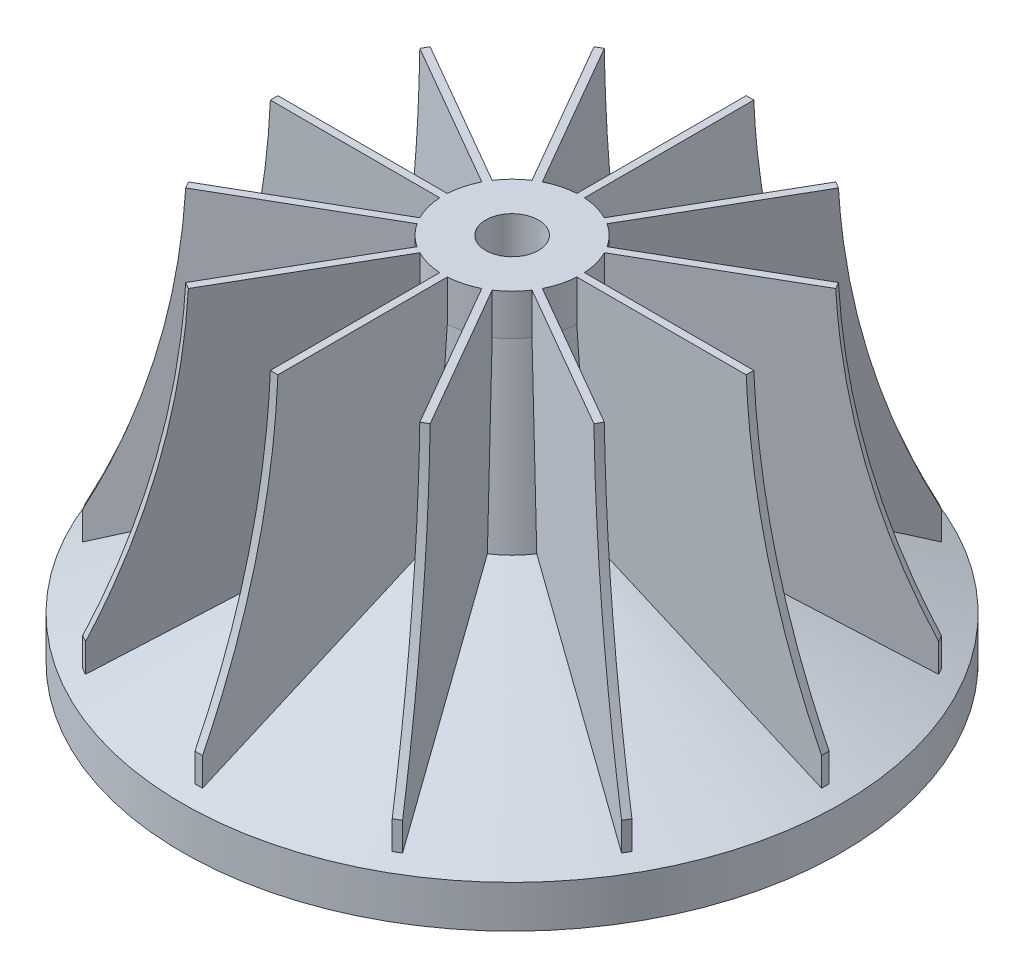
from build123d import *

# Parameters (mm, degrees)
BOSS_EXTRUDE5_REACH = 73.526
CIRPATTERN8_COUNT   = 12
CUT_EXTRUDE1_REACH  = 73.526
SKETCH6_R           = 3.175


with BuildPart() as part:
    # Sketch1 → Revolve1 (revolve)
    with BuildSketch(Plane.XY):
        Polygon((0, 0), (-39.624, 0), (-39.624, 5.08), (-9.822923796, 18.069281233), (-8.255, 39.518150017), (-8.255, 44.45), (0, 44.45), align=None)
    revolve(axis=Axis((0, 0, 0), (0, 1, 0)))

    # Sketch3 → Boss-Extrude5 (add, up to next)
    with BuildSketch(Plane(origin=(0, 44.45, 0), x_dir=(1, 0, 0), z_dir=(0, 1, 0)), mode=Mode.PRIVATE) as boss_extrude5_sk1:
        with BuildLine():
            Line((0.455930282, -37.670191496), (0.455991802, -8.206191496))
            add(Edge.make_bspline(
                [(-0.45593, -8.206191496), (3.0201e-05, -8.303808504), (0.455991802, -8.206191496)],
                knots=[0, 0, 0, 1, 1, 1], degree=2))
            Line((-0.45593, -8.206191496), (-0.45593, -37.670191496))
            Line((-0.45593, -37.670191496), (0.455930282, -37.670191496))
        make_face()
    boss_extrude5_tool1 = extrude(boss_extrude5_sk1.sketch, amount=-BOSS_EXTRUDE5_REACH, mode=Mode.PRIVATE) - part.part
    boss_extrude5 = boss_extrude5_tool1.solids().sort_by_distance((1.6e-05, 44.45, 22.954292))[0]
    add(boss_extrude5)

    # CirPattern8: Boss-Extrude5 ×12 about axis
    cirpattern8_axis = Axis((0, 18.069281233, 0), (0, 1, 0))
    for i in range(1, CIRPATTERN8_COUNT):
        add(boss_extrude5.rotate(cirpattern8_axis, i * 360 / CIRPATTERN8_COUNT))

    # Sketch7 → Cut-Revolve3 (revolve, cut)
    with BuildSketch(Plane(origin=(0, 0, 0), x_dir=(0, 0, -1), z_dir=(1, 0, 0))):
        with BuildLine():
            Line((-42.13340627, 53.486181243), (-28.575, 53.486181243))
            Line((-28.575, 53.486181243), (-28.575, 45.258268752))
            add(Edge.make_bspline(
                [(-28.575, 45.258268752), (-29.259976599, 26.307663759), (-37.670191496, 9.339538931)],
                knots=[0, 0, 0, 1, 1, 1], degree=2))
            Line((-37.670191496, 9.339538931), (-42.68469114, 9.339538931))
            Line((-42.68469114, 9.339538931), (-42.13340627, 53.486181243))
        make_face()
    revolve(axis=Axis((0, 0, 0), (0, 1, 0)), mode=Mode.SUBTRACT)

    # Sketch6 → Cut-Extrude1 (cut, up to next)
    with BuildSketch(Plane(origin=(0, 44.45, 0), x_dir=(1, 0, 0), z_dir=(0, 1, 0)), mode=Mode.PRIVATE) as cut_extrude1_sk1:
        Circle(SKETCH6_R)
    cut_extrude1_tool1 = extrude(cut_extrude1_sk1.sketch, amount=-CUT_EXTRUDE1_REACH, mode=Mode.PRIVATE) & part.part
    add(cut_extrude1_tool1.solids().sort_by_distance((0, 44.45, 0))[0], mode=Mode.SUBTRACT)


solid = part.part
